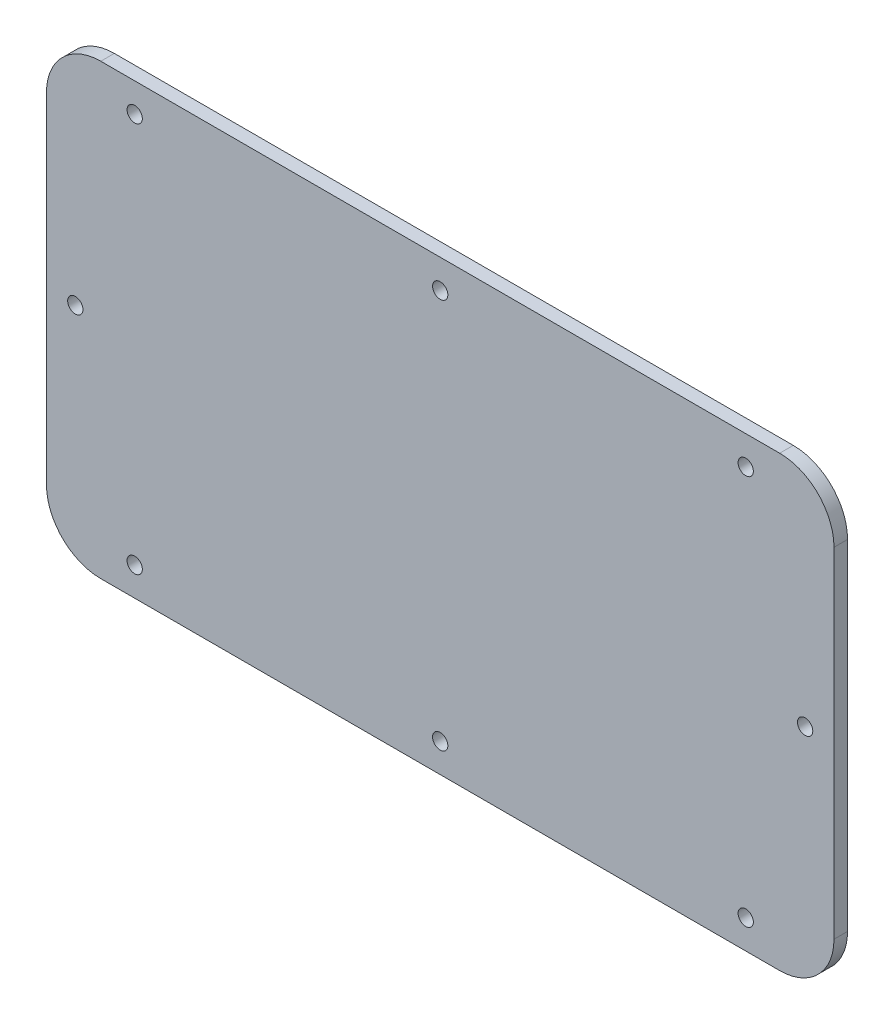
from build123d import *

# Parameters (mm, degrees)
SKETCH_1_W             = 232
SKETCH_1_H             = 132
SKETCH_1_R             = 2.25
SM_BASE_FLANGE_1_DEPTH = 4
FILLET_1_R             = 16


# Sheet-metal steps are written as plain solids
with BuildPart() as part:
    # Sketch 1 → Базовая кромка1 (new body)
    with BuildSketch(Plane.XY):
        Rectangle(SKETCH_1_W, SKETCH_1_H)
        with Locations((0, 57.5)):
            Circle(SKETCH_1_R, mode=Mode.SUBTRACT)
        with Locations((-90, 57.5)):
            Circle(SKETCH_1_R, mode=Mode.SUBTRACT)
        with Locations((90, 57.5)):
            Circle(SKETCH_1_R, mode=Mode.SUBTRACT)
        with Locations((-107.5, 0)):
            Circle(SKETCH_1_R, mode=Mode.SUBTRACT)
        with Locations((107.5, 0)):
            Circle(SKETCH_1_R, mode=Mode.SUBTRACT)
        with Locations(Location((90, -57.5, 0), (0, 0, 180))):
            Circle(SKETCH_1_R, mode=Mode.SUBTRACT)
        with Locations(Location((0, -57.5, 0), (0, 0, 180))):
            Circle(SKETCH_1_R, mode=Mode.SUBTRACT)
        with Locations(Location((-90, -57.5, 0), (0, 0, 180))):
            Circle(SKETCH_1_R, mode=Mode.SUBTRACT)
    extrude(amount=-SM_BASE_FLANGE_1_DEPTH)

    # Скругление1
    fillet_1_edges = [part.edges().sort_by_distance(p)[0] for p in [
        (-116, 66, -2),
        (116, 66, -2),
        (116, -66, -2),
        (-116, -66, -2),
    ]]
    fillet(fillet_1_edges, radius=FILLET_1_R)


solid = part.part
